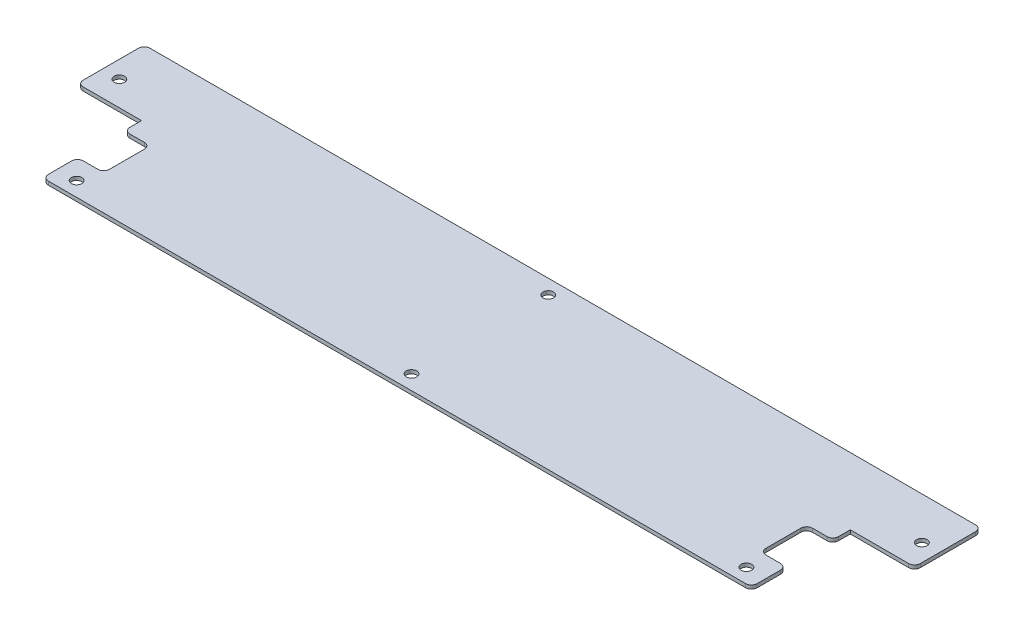
from build123d import *

# Parameters (mm, degrees)
SKETCH1_R           = 2.286
BOSS_EXTRUDE1_DEPTH = 1.5875
FILLET1_R           = 2.54
SKETCH2_W           = 11.43
SKETCH2_H           = 20.32
CUT_EXTRUDE1_DEPTH  = 2.54
FILLET2_R           = 2.54


with BuildPart() as part:
    # Sketch1 → Boss-Extrude1 (new body)
    with BuildSketch(Plane(origin=(0, 0, 0), x_dir=(1, 0, 0), z_dir=(0, 1, 0))):
        Polygon((-154.686, -36.195), (-154.686, 6.985), (-182.708271591, 6.985), (-182.708271591, 36.195), (182.708271591, 36.195), (182.708271591, 6.985), (154.686, 6.985), (154.686, -36.195), align=None)
        with Locations((175.1457, 17.78)):
            Circle(SKETCH1_R, mode=Mode.SUBTRACT)
        with Locations((0, 29.845)):
            Circle(SKETCH1_R, mode=Mode.SUBTRACT)
        with Locations((146.177, -29.845)):
            Circle(SKETCH1_R, mode=Mode.SUBTRACT)
        with Locations((-175.1457, 17.78)):
            Circle(SKETCH1_R, mode=Mode.SUBTRACT)
        with Locations((0, -29.845)):
            Circle(SKETCH1_R, mode=Mode.SUBTRACT)
        with Locations((-146.177, -29.845)):
            Circle(SKETCH1_R, mode=Mode.SUBTRACT)
    extrude(amount=BOSS_EXTRUDE1_DEPTH)

    # Fillet1
    fillet1_edges = [part.edges().sort_by_distance(p)[0] for p in [
        (182.708271591, 0.79375, -6.985),
        (182.708271591, 0.79375, -36.195),
        (154.686, 0.79375, 36.195),
        (-154.686, 0.79375, 36.195),
        (-182.708271591, 0.79375, -36.195),
        (-182.708271591, 0.79375, -6.985),
    ]]
    fillet(fillet1_edges, radius=FILLET1_R)

    # Sketch2 → Cut-Extrude1 (cut)
    with BuildSketch(Plane(origin=(0, 1.5875, 0), x_dir=(1, 0, 0), z_dir=(0, 1, 0))):
        with Locations((-148.971, -10.795)):
            Rectangle(SKETCH2_W, SKETCH2_H)
        with Locations((148.971, -10.795)):
            Rectangle(SKETCH2_W, SKETCH2_H)
    extrude(amount=-CUT_EXTRUDE1_DEPTH, mode=Mode.SUBTRACT)

    # Fillet2
    fillet2_edges = [part.edges().sort_by_distance(p)[0] for p in [
        (154.686, 0.79375, 20.955),
        (143.256, 0.79375, 20.955),
        (143.256, 0.79375, 0.635),
        (154.686, 0.79375, 0.635),
        (-154.686, 0.79375, 20.955),
        (-143.256, 0.79375, 20.955),
        (-143.256, 0.79375, 0.635),
        (-154.686, 0.79375, 0.635),
    ]]
    fillet(fillet2_edges, radius=FILLET2_R)


solid = part.part
